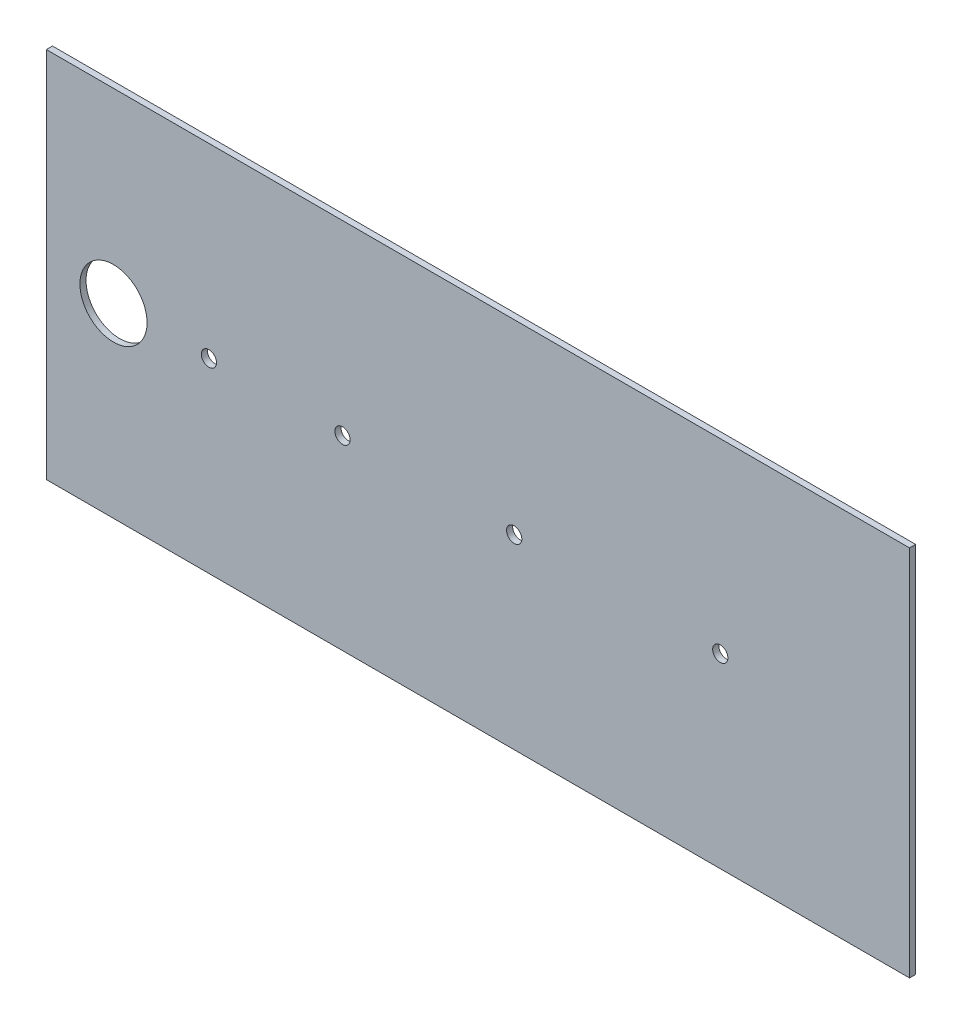
from build123d import *

# Parameters (mm, degrees)
SKETCH_1_W      = 282.75
SKETCH_1_H      = 122
SKETCH_1_R      = 2.5
SKETCH_1_R_2    = 11
EXTRUDE_1_DEPTH = 2


with BuildPart() as part:
    # Эскиз1 → Бобышка-Вытянуть1 (new body)
    with BuildSketch(Plane.XY):
        with Locations((141.375, 61)):
            Rectangle(SKETCH_1_W, SKETCH_1_H)
        with Locations((220.75, 61)):
            Circle(SKETCH_1_R, mode=Mode.SUBTRACT)
        with Locations((153.25, 61)):
            Circle(SKETCH_1_R, mode=Mode.SUBTRACT)
        with Locations((97, 61)):
            Circle(SKETCH_1_R, mode=Mode.SUBTRACT)
        with Locations((53.25, 61)):
            Circle(SKETCH_1_R, mode=Mode.SUBTRACT)
        with Locations((22, 61)):
            Circle(SKETCH_1_R_2, mode=Mode.SUBTRACT)
    extrude(amount=EXTRUDE_1_DEPTH)


solid = part.part
